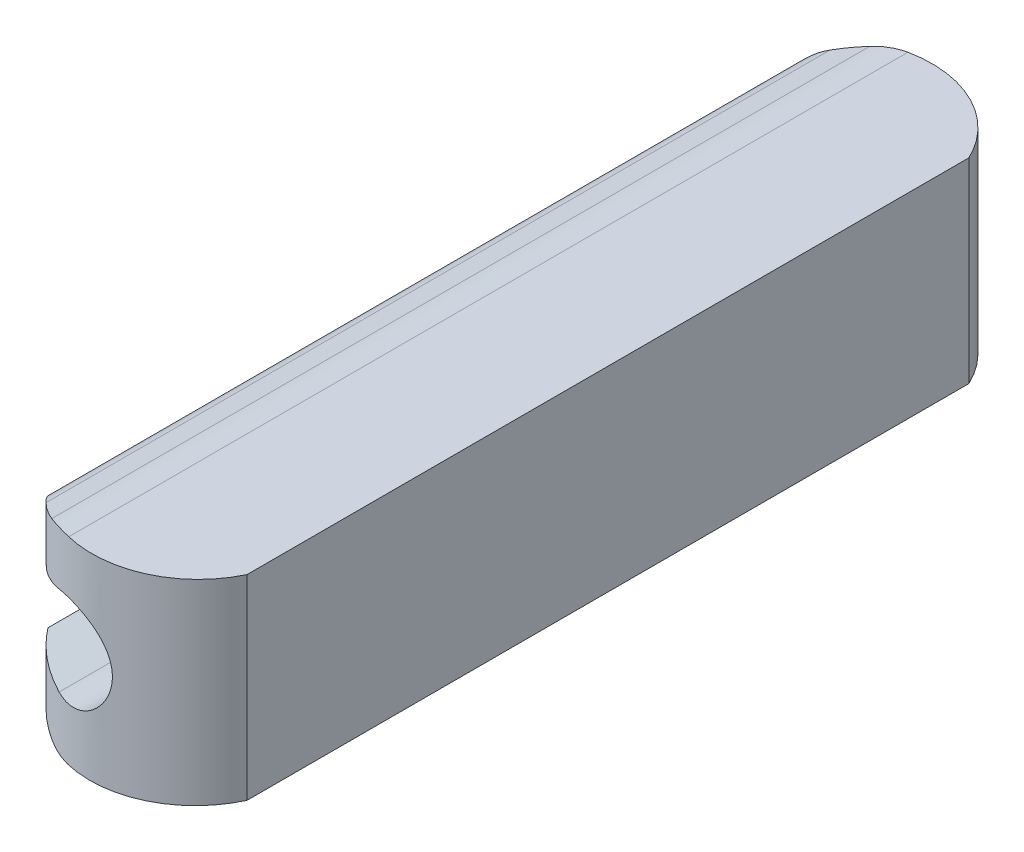
from build123d import *

# Parameters (mm, degrees)
EXTRUDE_THIN1_DEPTH     = 16
BOSS_EXTRUDE2_DEPTH     = 16
FILLET1_R               = 1
CUT_EXTRUDE2_DEPTH      = 18.058758847
CUT_EXTRUDE2_DEPTH_BACK = 18.058758847


# Read off the part's stored shape, not the designer's step: Imported1
with BuildPart() as part:
    # Sketch2 → Extrude-Thin1 (new, symmetric)
    with BuildSketch(Plane.XY):
        with BuildLine():
            Line((-4.282991407, -1.199997312), (-2.45293323, -1.69036477))
            ThreePointArc((-2.45293323, -1.69036477), (-0.24999913, 2.688e-06), (-2.45293323, 1.690370147))
            Line((-2.45293323, 1.690370147), (-4.282991407, 1.200002688))
            Line((-4.282991407, 1.200002688), (-4.800634272, 3.131853062))
            Line((-4.800634272, 3.131853062), (-2.970575647, 3.62222064))
            ThreePointArc((-2.970575647, 3.62222064), (1.75000087, 2.688e-06), (-2.970575649, -3.622215263))
            Line((-2.970575649, -3.622215263), (-4.800634272, -3.131847685))
            Line((-4.800634272, -3.131847685), (-4.282991407, -1.199997312))
        make_face()
    extrude(amount=EXTRUDE_THIN1_DEPTH, both=True)

    # Sketch4 → Boss-Extrude2 (add, symmetric)
    with BuildSketch(Plane.XY):
        with BuildLine():
            Line((2.602765718, -3.74999537), (2.602765718, 3.659682334))
            Line((2.602765718, 3.659682334), (-1.925829051, 3.749267219))
            ThreePointArc((-1.925829051, 3.749267219), (1.749817484, -0.037083193), (-1.999997188, -3.74999537))
            Line((-1.999997188, -3.74999537), (2.602765718, -3.74999537))
        make_face()
    extrude(amount=BOSS_EXTRUDE2_DEPTH, both=True)

    # Fillet1
    fillet1_edges = [part.edges().sort_by_distance(p)[0] for p in [
        (-4.800634272, 3.131853062, 0),
        (-4.800634272, -3.131847685, 0),
    ]]
    fillet(fillet1_edges, radius=FILLET1_R)

    # Sketch3 → Cut-Extrude2 (cut, two sides: drawn at the far end of the back side and taken through both)
    with BuildSketch(Plane(origin=(0, 0, 0), x_dir=(1, 0, 0), z_dir=(0, 1, 0)).offset(-CUT_EXTRUDE2_DEPTH_BACK)):
        with BuildLine():
            Line((2.738864814, 13.342061251), (2.738864814, 18.762901752))
            Line((2.738864814, 18.762901752), (-4.800634272, 18.762901752))
            Line((-4.800634272, 18.762901752), (-4.800634272, 13.342061251))
            ThreePointArc((-4.800634272, 13.342061251), (-1.030884729, 16), (2.738864814, 13.342061251))
        make_face()
        with BuildLine():
            Line((-4.800634272, -18.762901752), (-4.800634272, -13.342061251))
            ThreePointArc((-4.800634272, -13.342061251), (-1.030884729, -16), (2.738864814, -13.342061251))
            Line((2.738864814, -13.342061251), (2.738864814, -18.762901752))
            Line((2.738864814, -18.762901752), (-4.800634272, -18.762901752))
        make_face()
    extrude(amount=CUT_EXTRUDE2_DEPTH + CUT_EXTRUDE2_DEPTH_BACK, mode=Mode.SUBTRACT)


solid = part.part
